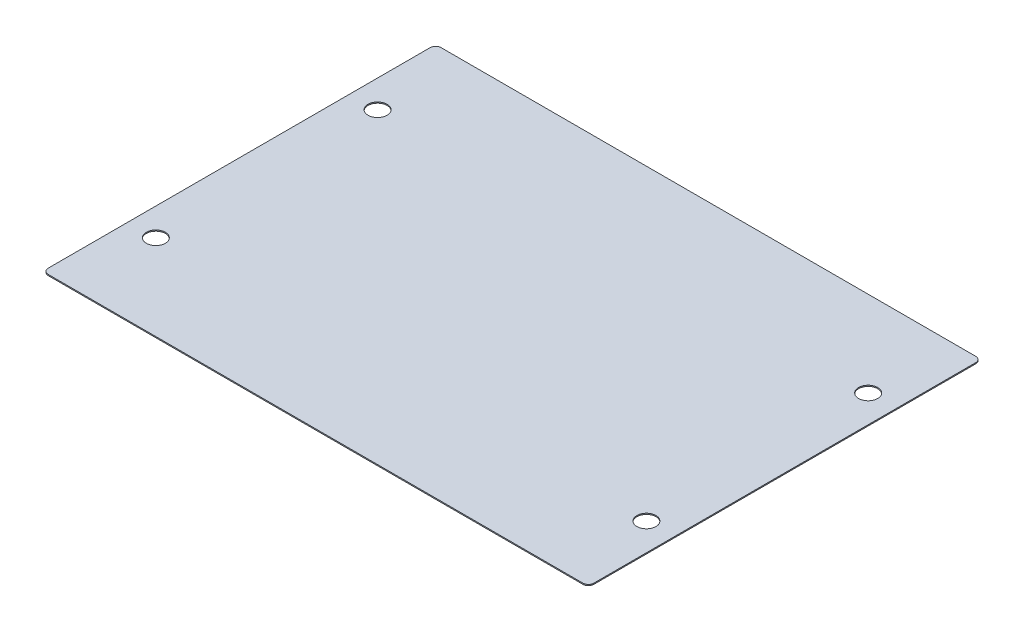
from build123d import *

# Parameters (mm, degrees)
SKETCH2_R           = 0.875
BOSS_EXTRUDE2_DEPTH = 0.1


with BuildPart() as part:
    # Sketch2 → Boss-Extrude2 (new body)
    with BuildSketch(Plane(origin=(0, 0, 0), x_dir=(1, 0, 0), z_dir=(0, 1, 0))):
        with BuildLine():
            Line((0.571096029, -14.068724413), (0.571096029, 20.931275587))
            ThreePointArc((0.571096029, 20.931275587), (0.42464942, 21.284828977), (0.071096029, 21.431275587))
            Line((0.071096029, 21.431275587), (-48.928903971, 21.431275587))
            ThreePointArc((-48.928903971, 21.431275587), (-49.282457361, 21.284828977), (-49.428903971, 20.931275587))
            Line((-49.428903971, 20.931275587), (-49.428903971, -14.068724413))
            ThreePointArc((-49.428903971, -14.068724413), (-49.282457361, -14.422277804), (-48.928903971, -14.568724413))
            Line((-48.928903971, -14.568724413), (0.071096029, -14.568724413))
            ThreePointArc((0.071096029, -14.568724413), (0.42464942, -14.422277804), (0.571096029, -14.068724413))
        make_face()
        with Locations((-1.948903971, 13.591275587)):
            Circle(SKETCH2_R, mode=Mode.SUBTRACT)
        with Locations((-46.908903971, 13.591275587)):
            Circle(SKETCH2_R, mode=Mode.SUBTRACT)
        with Locations((-46.908903971, -6.728724413)):
            Circle(SKETCH2_R, mode=Mode.SUBTRACT)
        with Locations((-1.948903971, -6.728724413)):
            Circle(SKETCH2_R, mode=Mode.SUBTRACT)
    extrude(amount=BOSS_EXTRUDE2_DEPTH)


solid = part.part
